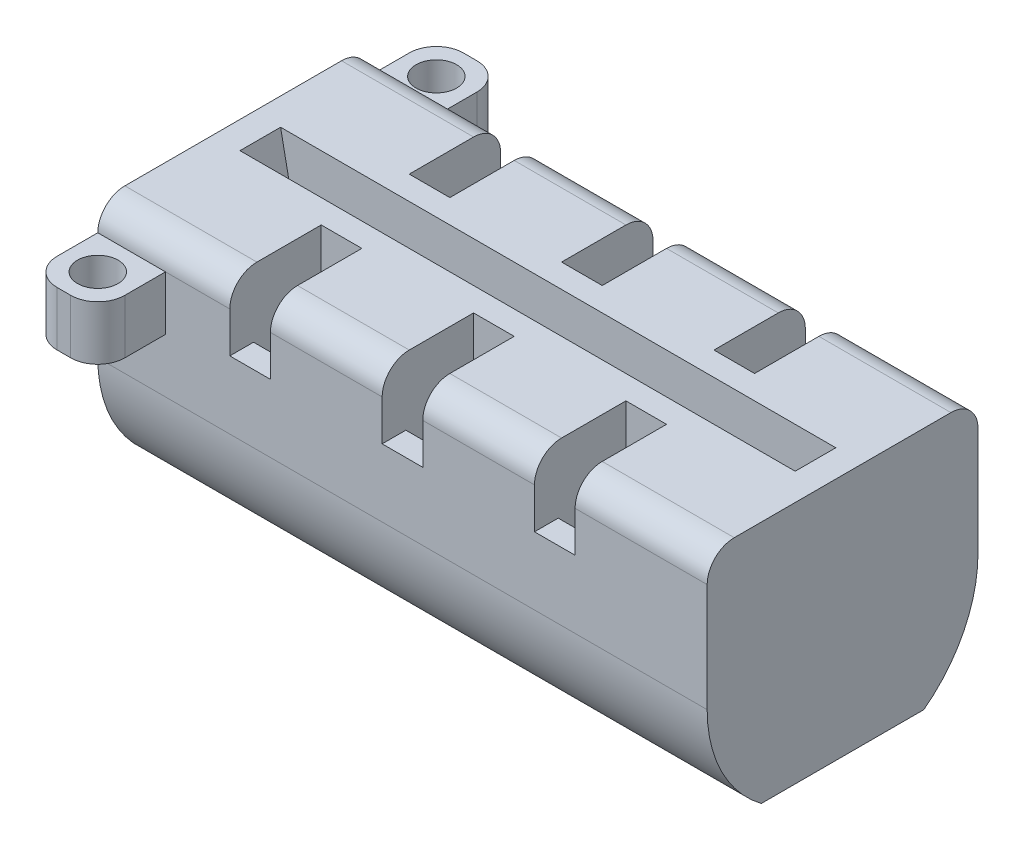
from build123d import *

# Parameters (mm, degrees)
SKETCH1_W            = 90
SKETCH1_H            = 20
BOSS_EXTRUDE1_DEPTH  = 20
SKETCH2_W            = 90
SKETCH2_H            = 3
CUT_EXTRUDE1_DEPTH   = 10
SKETCH3_W            = 3
SKETCH3_H            = 5
CUT_EXTRUDE2_DEPTH   = 10
SKETCH4_W            = 3
SKETCH4_H            = 1.75
SKETCH4_W_2          = 2.997618753
SKETCH4_W_3          = 3.002941468
CUT_EXTRUDE3_DEPTH   = 5
SKETCH5_W            = 1.5
SKETCH5_H            = 3
BOSS_EXTRUDE2_DEPTH  = 10
SKETCH6_W            = 1.5
SKETCH6_H            = 3
BOSS_EXTRUDE3_DEPTH  = 18
BOSS_EXTRUDE4_DEPTH  = 5
FILLET1_START        = 8.5
FILLET1_DEPTH        = 3
FILLET1_START_2      = 8
FILLET1_2_DEPTH      = 4
FILLET2_R            = 10
SKETCH8_W            = 20.140972823
SKETCH8_H            = 2
CUT_EXTRUDE4_DEPTH   = 119
FILLET3_R            = 2
SKETCH9_W            = 5
SKETCH9_H            = 4
BOSS_EXTRUDE6_DEPTH  = 5
SKETCH11_W           = 5
SKETCH11_H           = 4
BOSS_EXTRUDE7_DEPTH  = 5
SKETCH12_R           = 1.5
CUT_EXTRUDE5_DEPTH   = 24
FILLET4_R            = 2
SKETCH14_W           = 71.95999564
SKETCH14_H           = 44.647918029
CUT_EXTRUDE8_DEPTH   = 55
BOSS_EXTRUDE8_START  = 1.5
BOSS_EXTRUDE8_DEPTH  = 1.5
SKETCH16_W           = 5.976122604
SKETCH16_H           = 3
CUT_EXTRUDE9_DEPTH   = 10
SKETCH17_W           = 2
SKETCH17_H           = 3
BOSS_EXTRUDE9_DEPTH  = 10
BOSS_EXTRUDE10_DEPTH = 5


with BuildPart() as part:
    # Sketch1 → Boss-Extrude1 (new body)
    with BuildSketch(Plane.XY):
        with Locations((45, -10)):
            Rectangle(SKETCH1_W, SKETCH1_H)
    extrude(amount=BOSS_EXTRUDE1_DEPTH)

    # Sketch2 → Cut-Extrude1 (cut)
    with BuildSketch(Plane(origin=(0, 0, 0), x_dir=(1, 0, 0), z_dir=(0, 1, 0))):
        with Locations((45, -10)):
            Rectangle(SKETCH2_W, SKETCH2_H)
    extrude(amount=-CUT_EXTRUDE1_DEPTH, mode=Mode.SUBTRACT)

    # Sketch3 → Cut-Extrude2 (cut)
    with BuildSketch(Plane(origin=(0, 0, 0), x_dir=(1, 0, 0), z_dir=(0, 1, 0))):
        with Locations((11.25, -15.75)):
            Rectangle(SKETCH3_W, SKETCH3_H)
        with Locations((22.5, -15.75)):
            Rectangle(SKETCH3_W, SKETCH3_H)
        with Locations((33.75, -15.75)):
            Rectangle(SKETCH3_W, SKETCH3_H)
        with Locations((45, -15.75)):
            Rectangle(SKETCH3_W, SKETCH3_H)
        with Locations((56.25, -15.75)):
            Rectangle(SKETCH3_W, SKETCH3_H)
        with Locations((67.5, -15.75)):
            Rectangle(SKETCH3_W, SKETCH3_H)
        with Locations((78.75, -15.75)):
            Rectangle(SKETCH3_W, SKETCH3_H)
        with Locations((11.25, -4.25)):
            Rectangle(SKETCH3_W, SKETCH3_H)
        with Locations((22.5, -4.25)):
            Rectangle(SKETCH3_W, SKETCH3_H)
        with Locations((33.75, -4.25)):
            Rectangle(SKETCH3_W, SKETCH3_H)
        with Locations((45, -4.25)):
            Rectangle(SKETCH3_W, SKETCH3_H)
        with Locations((56.25, -4.25)):
            Rectangle(SKETCH3_W, SKETCH3_H)
        with Locations((67.5, -4.25)):
            Rectangle(SKETCH3_W, SKETCH3_H)
        with Locations((78.75, -4.25)):
            Rectangle(SKETCH3_W, SKETCH3_H)
    extrude(amount=-CUT_EXTRUDE2_DEPTH, mode=Mode.SUBTRACT)

    # Sketch4 → Cut-Extrude3 (cut)
    with BuildSketch(Plane(origin=(0, 0, 0), x_dir=(1, 0, 0), z_dir=(0, 1, 0))):
        with Locations((56.25, -19.125)):
            Rectangle(SKETCH4_W, SKETCH4_H)
        with Locations((67.5, -19.125)):
            Rectangle(SKETCH4_W, SKETCH4_H)
        Polygon((77.25, -18.25), (77.25, -20), (80.252941468, -20), (80.252941468, -18.25), (80.25, -18.25), align=None)
        with Locations((45, -19.125)):
            Rectangle(SKETCH4_W, SKETCH4_H)
        with Locations((33.748809377, -19.125)):
            Rectangle(SKETCH4_W_2, SKETCH4_H)
        with Locations((22.5, -19.125)):
            Rectangle(SKETCH4_W, SKETCH4_H)
        with Locations((11.25, -19.125)):
            Rectangle(SKETCH4_W, SKETCH4_H)
        with Locations((22.5, -0.875)):
            Rectangle(SKETCH4_W, SKETCH4_H)
        with Locations((33.748809377, -0.875)):
            Rectangle(SKETCH4_W_2, SKETCH4_H)
        with Locations((45, -0.875)):
            Rectangle(SKETCH4_W, SKETCH4_H)
        with Locations((56.25, -0.875)):
            Rectangle(SKETCH4_W, SKETCH4_H)
        with Locations((67.5, -0.875)):
            Rectangle(SKETCH4_W, SKETCH4_H)
        with Locations((78.751470734, -0.875)):
            Rectangle(SKETCH4_W_3, SKETCH4_H)
        with Locations((11.25, -0.875)):
            Rectangle(SKETCH4_W, SKETCH4_H)
    extrude(amount=-CUT_EXTRUDE3_DEPTH, mode=Mode.SUBTRACT)

    # Sketch5 → Boss-Extrude2 (add)
    with BuildSketch(Plane(origin=(0, -10, 0), x_dir=(1, 0, 0), z_dir=(0, 1, 0))):
        with Locations((0.75, -10)):
            Rectangle(SKETCH5_W, SKETCH5_H)
        with Locations((89.25, -10)):
            Rectangle(SKETCH5_W, SKETCH5_H)
    extrude(amount=BOSS_EXTRUDE2_DEPTH)

    # Sketch6 → Boss-Extrude3 (add)
    with BuildSketch(Plane(origin=(0, 0, 0), x_dir=(1, 0, 0), z_dir=(0, 1, 0))):
        with Locations((2.25, -10)):
            Rectangle(SKETCH6_W, SKETCH6_H)
        with Locations((87.75, -10)):
            Rectangle(SKETCH6_W, SKETCH6_H)
    extrude(amount=-BOSS_EXTRUDE3_DEPTH)

    # Sketch7 → Boss-Extrude4 (add)
    with BuildSketch(Plane.XY.offset(8.5)):
        Polygon((3, -9.907661673), (3, -10), (6, -10), (3, 0), align=None)
        Polygon((87, 0), (84, -10), (87, -10), align=None)
    extrude(amount=BOSS_EXTRUDE4_DEPTH)

    # Fillet1: read off the stored shape, not the designer's step
    # Fillet1 outline → Fillet1 (cut)
    with BuildSketch(Plane.XY.offset(FILLET1_START)):
        with BuildLine():
            ThreePointArc((1.511938698, 0), (2.705799758, -0.395414143), (3.427591269, -1.425304229))
            Line((3.427591269, -1.425304229), (3, 0))
            Line((3, 0), (1.511938698, 0))
        make_face()
        with BuildLine():
            Line((87, 0), (86.572408731, -1.425304229))
            ThreePointArc((86.572408731, -1.425304229), (87.294200242, -0.395414143), (88.488061302, 0))
            Line((88.488061302, 0), (87, 0))
        make_face()
    extrude(amount=FILLET1_DEPTH, mode=Mode.SUBTRACT)

    # Fillet1 2 outline → Fillet1 2 (add)
    with BuildSketch(Plane.XY.offset(FILLET1_START_2)):
        with BuildLine():
            Line((6, -10), (7.488061302, -10))
            ThreePointArc((7.488061302, -10), (6.294200242, -9.604585857), (5.572408731, -8.574695771))
            Line((5.572408731, -8.574695771), (6, -10))
        make_face()
        with BuildLine():
            ThreePointArc((84.427591269, -8.574695771), (83.705799758, -9.604585857), (82.511938698, -10))
            Line((82.511938698, -10), (84, -10))
            Line((84, -10), (84.427591269, -8.574695771))
        make_face()
    extrude(amount=FILLET1_2_DEPTH)

    # Fillet2
    fillet2_edges = [part.edges().sort_by_distance(p)[0] for p in [
        (45, -20, 0),
        (45, -20, 20),
    ]]
    fillet(fillet2_edges, radius=FILLET2_R - 0.0001)  # a hair under: the kernel refuses the full size

    # Sketch8 → Cut-Extrude4 (cut)
    with BuildSketch(Plane.ZY):
        with Locations((10.770725067, -19)):
            Rectangle(SKETCH8_W, SKETCH8_H)
    extrude(amount=-CUT_EXTRUDE4_DEPTH, mode=Mode.SUBTRACT)

    # Fillet3
    fillet3_edges = [part.edges().sort_by_distance(p)[0] for p in [
        (4.875, 0, 0),
        (4.875, 0, 20),
        (16.875, 0, 20),
        (16.875, 0, 0),
        (28.125, 0, 0),
        (28.125, 0, 20),
        (39.373809377, 0, 20),
        (39.373809377, 0, 0),
        (50.625, 0, 0),
        (50.625, 0, 20),
        (61.875, 0, 20),
        (61.875, 0, 0),
        (73.125, 0, 0),
        (73.125, 0, 20),
        (85.126470734, 0, 20),
        (85.126470734, 0, 0),
    ]]
    fillet(fillet3_edges, radius=FILLET3_R)

    # Sketch9 → Boss-Extrude6 (add)
    with BuildSketch(Plane.ZY):
        with Locations((-2.5, -4)):
            Rectangle(SKETCH9_W, SKETCH9_H)
        with Locations((22.5, -4)):
            Rectangle(SKETCH9_W, SKETCH9_H)
    extrude(amount=-BOSS_EXTRUDE6_DEPTH)

    # Sketch11 → Boss-Extrude7 (add)
    with BuildSketch(Plane(origin=(90, 0, 0), x_dir=(0, 0, -1), z_dir=(1, 0, 0))):
        with Locations((2.5, -4)):
            Rectangle(SKETCH11_W, SKETCH11_H)
        with Locations((-22.5, -4)):
            Rectangle(SKETCH11_W, SKETCH11_H)
    extrude(amount=-BOSS_EXTRUDE7_DEPTH)

    # Sketch12 → Cut-Extrude5 (cut)
    with BuildSketch(Plane(origin=(0, -2, 0), x_dir=(1, 0, 0), z_dir=(0, 1, 0))):
        with Locations(Location((2.5, 2.5, 0), (0, 0, 180))):
            Circle(SKETCH12_R)
        with Locations(Location((87.5, 2.5, 0), (0, 0, 180))):
            Circle(SKETCH12_R)
        with Locations(Location((87.5, -22.5, 0), (0, 0, 180))):
            Circle(SKETCH12_R)
        with Locations(Location((2.5, -22.5, 0), (0, 0, 180))):
            Circle(SKETCH12_R)
    extrude(amount=-CUT_EXTRUDE5_DEPTH, mode=Mode.SUBTRACT)

    # Fillet4
    fillet4_edges = [part.edges().sort_by_distance(p)[0] for p in [
        (0, -4, -5),
        (5, -4, -5),
        (5, -4, 25),
        (0, -4, 25),
        (85, -4, -5),
        (90, -4, -5),
        (85, -4, 25),
        (90, -4, 25),
    ]]
    fillet(fillet4_edges, radius=FILLET4_R)

    # Sketch14 → Cut-Extrude8 (cut)
    with BuildSketch(Plane(origin=(0, 0, 0), x_dir=(1, 0, 0), z_dir=(0, 1, 0))):
        with Locations((79.47999782, -11.65925291)):
            Rectangle(SKETCH14_W, SKETCH14_H)
    extrude(amount=-CUT_EXTRUDE8_DEPTH, mode=Mode.SUBTRACT)

    # Sketch15 → Boss-Extrude8 (add)
    with BuildSketch(Plane(origin=(43.5, 0, 0), x_dir=(0, 0, -1), z_dir=(1, 0, 0)).offset(BOSS_EXTRUDE8_START)):
        with BuildLine():
            Line((-11.5, 0), (-18, 0))
            ThreePointArc((-18, 0), (-19.414213562, -0.585786438), (-20, -2))
            Line((-20, -2), (-20, -10))
            ThreePointArc((-20, -10), (-18.94427191, -14.472135955), (-16, -18))
            Line((-16, -18), (-4, -18))
            ThreePointArc((-4, -18), (-1.05572809, -14.472135955), (0, -10))
            Line((0, -10), (0, -2))
            ThreePointArc((0, -2), (-0.585786438, -0.585786438), (-2, 0))
            Line((-2, 0), (-4, 0))
            Line((-4, 0), (-8.5, 0))
            Line((-8.5, 0), (-8.5, -10))
            Line((-8.5, -10), (-11.5, -10))
            Line((-11.5, -10), (-11.5, 0))
        make_face()
    extrude(amount=-BOSS_EXTRUDE8_DEPTH)

    # Sketch16 → Cut-Extrude9 (cut)
    with BuildSketch(Plane(origin=(0, 0, 0), x_dir=(1, 0, 0), z_dir=(0, 1, 0))):
        with Locations((4.5, -10)):
            Rectangle(SKETCH16_W, SKETCH16_H)
    extrude(amount=-CUT_EXTRUDE9_DEPTH, mode=Mode.SUBTRACT)

    # Sketch17 → Boss-Extrude9 (add)
    with BuildSketch(Plane(origin=(0, 0, 0), x_dir=(1, 0, 0), z_dir=(0, 1, 0))):
        Polygon((2, -8.5), (1.511938698, -8.5), (0, -8.5), (0, -11.5), (1.511938698, -11.5), (2, -11.5), align=None)
        with Locations((44, -10)):
            Rectangle(SKETCH17_W, SKETCH17_H)
    extrude(amount=-BOSS_EXTRUDE9_DEPTH)

    # Sketch18 → Boss-Extrude10 (add)
    with BuildSketch(Plane.XY.offset(8.5)):
        Polygon((4, -10), (2, 0), (2, -10), align=None)
        Polygon((43, 0), (41, -10), (43, -10), align=None)
    extrude(amount=BOSS_EXTRUDE10_DEPTH)


solid = part.part
